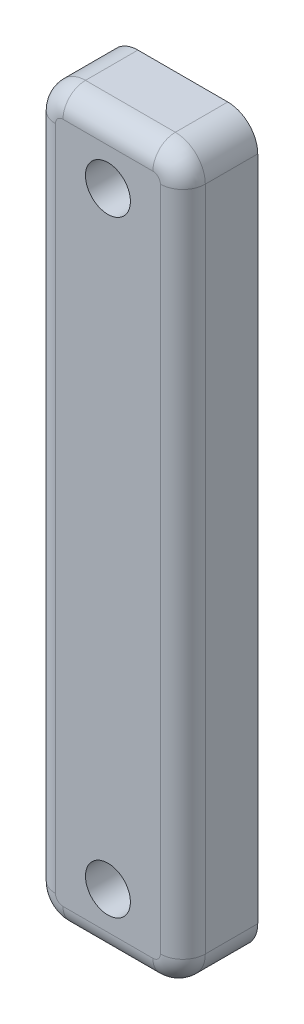
from build123d import *

# Parameters (mm, degrees)
BOSS_EXTRUDE1_DEPTH = 5
SKETCH4_R           = 1.5
CUT_EXTRUDE1_DEPTH  = 31.071464138
FILLET1_R           = 1.5


with BuildPart() as part:
    # Sketch2 → Boss-Extrude1 (new body)
    with BuildSketch(Plane.XY):
        with BuildLine():
            Line((8, 20.584180911), (2, 20.584180911))
            ThreePointArc((2, 20.584180911), (0.585786438, 19.998394474), (0, 18.584180911))
            Line((0, 18.584180911), (0, -25.915819089))
            ThreePointArc((0, -25.915819089), (0.585786438, -27.330032651), (2, -27.915819089))
            Line((2, -27.915819089), (8, -27.915819089))
            ThreePointArc((8, -27.915819089), (9.414213562, -27.330032651), (10, -25.915819089))
            Line((10, -25.915819089), (10, 18.584180911))
            ThreePointArc((10, 18.584180911), (9.414213562, 19.998394474), (8, 20.584180911))
        make_face()
    extrude(amount=BOSS_EXTRUDE1_DEPTH)

    # Sketch4 → Cut-Extrude1 (cut, through all)
    with BuildSketch(Plane(origin=(0, 0, 0), x_dir=(-1, 0, 0), z_dir=(0, 0, -1))):
        with Locations((-5, -23.915819089)):
            Circle(SKETCH4_R)
        with Locations((-5, 16.584180911)):
            Circle(SKETCH4_R)
    extrude(amount=-CUT_EXTRUDE1_DEPTH, mode=Mode.SUBTRACT)

    # Fillet1
    fillet1_edges = [part.edges().sort_by_distance(p)[0] for p in [
        (9.414213562, -27.330032651, 5),
        (5, -27.915819089, 5),
        (0.585786438, -27.330032651, 5),
        (0, -3.665819089, 5),
        (0.585786438, 19.998394474, 5),
        (5, 20.584180911, 5),
        (9.414213562, 19.998394474, 5),
        (10, -3.665819089, 5),
    ]]
    fillet(fillet1_edges, radius=FILLET1_R)


solid = part.part
